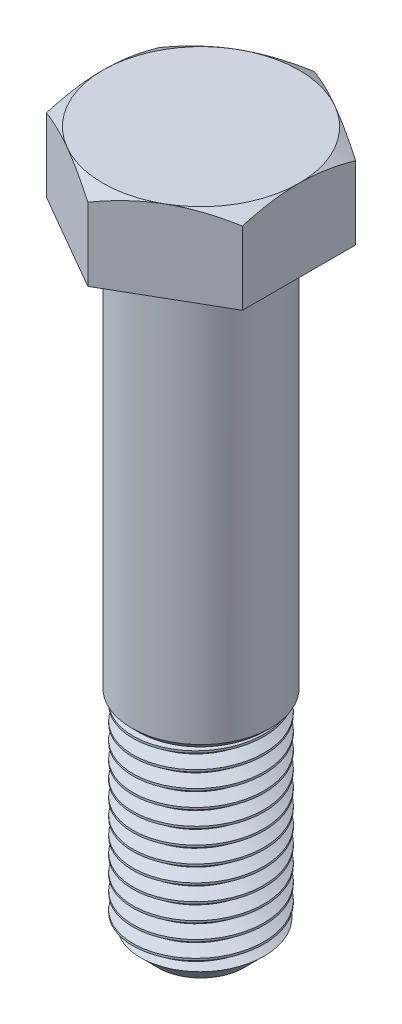
from build123d import *

# Parameters (mm, degrees)
HEX_2_DEPTH              = 10
SKETCH16_OUTSIDE_W       = 109.396
SKETCH16_OUTSIDE_H       = 113.108
SKETCH16_OUTSIDE_R       = 12
CHAMFER_CUT_DEPTH        = 21.880613018
CHAMFER_CUT_DRAFT        = -60
SKETCH4_R                = 8.5
UNTHREADED_PORTION_DEPTH = 49.5
SKETCH5_R                = 8
THREADED_PORTION_DEPTH   = 27
SHOULDER_CHAMFER_SIZE    = 0.5
END_CHAMFER_SIZE         = 2.7
SKETCH19_R               = 0.25
CUT_SWEEP1_PITCH         = 2


with BuildPart() as part:
    # Sketch1 → Hex 2 (new body)
    with BuildSketch(Plane(origin=(0, 0, 0), x_dir=(1, 0, 0), z_dir=(0, 1, 0))):
        Polygon((0, 13.856406461), (-12, 6.92820323), (-12, -6.92820323), (0, -13.856406461), (12, -6.92820323), (12, 6.92820323), align=None)
    extrude(amount=HEX_2_DEPTH)


with BuildPart() as chamfer_cut_tool:
    # Sketch16 outside → Chamfer Cut (with draft: the straight prism first)
    with BuildSketch(Plane(origin=(0, 10, 0), x_dir=(1, 0, 0), z_dir=(0, 1, 0))):
        Rectangle(SKETCH16_OUTSIDE_W, SKETCH16_OUTSIDE_H)
        Circle(SKETCH16_OUTSIDE_R, mode=Mode.SUBTRACT)
    extrude(amount=-CHAMFER_CUT_DEPTH)
    # Chamfer Cut: the draft: its side faces are tilted about the plane it starts from
    chamfer_cut_sides = [chamfer_cut_tool.faces().sort_by_distance(p)[0] for p in [
        (0, -0.940306509, 56.554),
        (54.698, -0.940306509, 0),
        (0, -0.940306509, -56.554),
        (-54.698, -0.940306509, 0),
        (-12, -0.940306509, 0),
    ]]
    draft(chamfer_cut_sides, Plane(origin=(0, 10, 0), x_dir=(1, 0, 0), z_dir=(0, 1, 0)), CHAMFER_CUT_DRAFT)


with BuildPart() as part_1:
    add(part.part)

    # Chamfer Cut: cut by chamfer_cut_tool
    add(chamfer_cut_tool.part, mode=Mode.SUBTRACT)

    # Sketch4 → Unthreaded Portion (add)
    with BuildSketch(Plane.XZ):
        with Locations(Location((0, 0, 0), (0, 0, 270))):
            Circle(SKETCH4_R)
    extrude(amount=UNTHREADED_PORTION_DEPTH)

    # Sketch5 → Threaded Portion (add)
    with BuildSketch(Plane.XZ.offset(49.5)):
        with Locations(Location((0, 0, 0), (0, 0, 270))):
            Circle(SKETCH5_R)
    extrude(amount=THREADED_PORTION_DEPTH)

    # Shoulder Chamfer
    shoulder_chamfer_edges = [part_1.edges().sort_by_distance(p)[0] for p in [
        (0, -49.5, 8),
    ]]
    chamfer(shoulder_chamfer_edges, length=SHOULDER_CHAMFER_SIZE - 0.0001)  # a hair under: the kernel refuses the full size

    # End Chamfer
    end_chamfer_edges = [part_1.edges().sort_by_distance(p)[0] for p in [
        (0, -76.5, 8),
    ]]
    chamfer(end_chamfer_edges, length=END_CHAMFER_SIZE)

    # Sketch19 → Cut-Revolve1 (revolve, cut)
    with BuildSketch(Plane(origin=(0, 0, 0), x_dir=(0, 0, -1), z_dir=(1, 0, 0))):
        with Locations((8.5, -0.25)):
            Circle(SKETCH19_R)
    revolve(axis=Axis((0, 0, 0), (0, -1, 0)), mode=Mode.SUBTRACT)

    # Cut-Sweep1: arcs per turn and ends read off the stored shape
    # Cut-Sweep1: the profile of Sketch13 profile screwed along a right-hand helix through 15 turns, 6 arcs to a turn; built about Z, then put on its axis
    cut_sweep1_z = Axis((0, 0, 0), (0, 0, 1))
    cut_sweep1_corners = [(8.0003, 0, 0.000173205), (8.0003, 0, -1.750173205), (6.700961894, 0, -1), (6.700961894, 0, -0.75)]
    with BuildLine(mode=Mode.PRIVATE) as cut_sweep1_profile:
        Line(cut_sweep1_corners[0], cut_sweep1_corners[1])
        Line(cut_sweep1_corners[1], cut_sweep1_corners[2])
        Line(cut_sweep1_corners[2], cut_sweep1_corners[3])
        Line(cut_sweep1_corners[3], cut_sweep1_corners[0])
    cut_sweep1_cap = Face(cut_sweep1_profile.wire())
    cut_sweep1_turn_angles = [0, 30, 60, 90, 120, 150, 180, 210, 240, 270, 300, 330, 360]
    cut_sweep1_turn_weights = [1, 0.8660254037844387, 1, 0.8660254037844387, 1, 0.8660254037844387, 1, 0.8660254037844387, 1, 0.8660254037844387, 1, 0.8660254037844387, 1]
    cut_sweep1_turn_rails = [Edge.make_bspline([Vector(p[0], p[1], 0).rotate(cut_sweep1_z, cut_sweep1_turn_angles[k]) / cut_sweep1_turn_weights[k] + Vector(0, 0, p[2] + CUT_SWEEP1_PITCH * cut_sweep1_turn_angles[k] / 360) for k in range(13)], [0, 0, 0, 1, 1, 2, 2, 3, 3, 4, 4, 5, 5, 6, 6, 6], 2, cut_sweep1_turn_weights) for p in cut_sweep1_corners]
    cut_sweep1_turn_sides = [Face.make_surface_from_curves(cut_sweep1_turn_rails[p[0]], cut_sweep1_turn_rails[p[1]]) for p in [(0, 1), (1, 2), (2, 3), (3, 0)]]
    cut_sweep1_turn = Solid(Shell([*cut_sweep1_turn_sides, cut_sweep1_cap, cut_sweep1_cap.rotate(cut_sweep1_z, 360).moved(Location((0, 0, CUT_SWEEP1_PITCH * 360 / 360)))]))
    cut_sweep1_each = [*[cut_sweep1_turn.moved(Location((0, 0, CUT_SWEEP1_PITCH * i))) for i in range(15)]]
    add(Plane(origin=(0, -76.5, 0), x_dir=(1, 0, 0), z_dir=(0, 1, 0)) * Compound([cut_sweep1_each[i] for i in range(0, 15, 2)]), mode=Mode.SUBTRACT)
    add(Plane(origin=(0, -76.5, 0), x_dir=(1, 0, 0), z_dir=(0, 1, 0)) * Compound([cut_sweep1_each[i] for i in range(1, 15, 2)]), mode=Mode.SUBTRACT)

    # Sketch18 → Cut Cleanup (revolve)
    with BuildSketch(Plane(origin=(0, 0, 0), x_dir=(0, 0, -1), z_dir=(1, 0, 0)), mode=Mode.PRIVATE) as cut_cleanup_sk:
        Polygon((8.5, -49.5), (8.5, -0.5), (0, -0.5), (0, -58), align=None)
    revolve(cut_cleanup_sk.sketch.rotate(Axis((0, -0.5, 0), (0, -1, 0)), 62.700451208), axis=Axis((0, -0.5, 0), (0, -1, 0)))


solid = part_1.part
